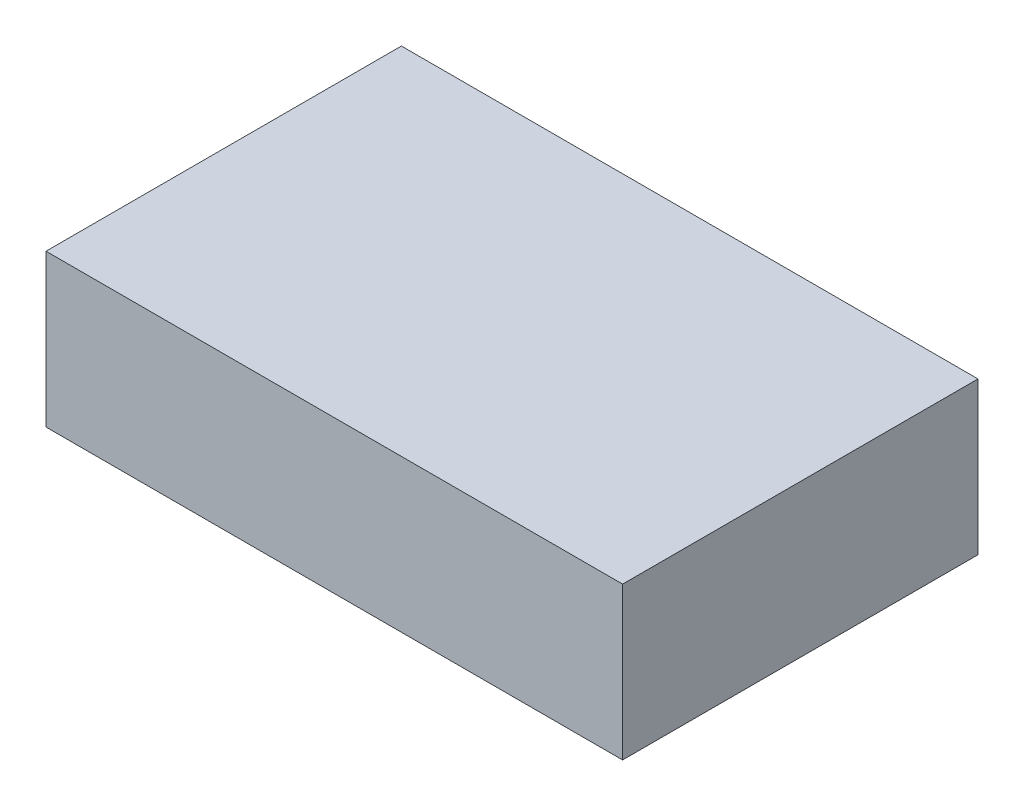
from build123d import *

# Parameters (mm, degrees)
SKETCH1_W           = 121.158
SKETCH1_H           = 74.676
BOSS_EXTRUDE1_DEPTH = 32.004


with BuildPart() as part:
    # Sketch1 → Boss-Extrude1 (new body)
    with BuildSketch(Plane(origin=(0, 0, 0), x_dir=(1, 0, 0), z_dir=(0, 1, 0))):
        with Locations((60.579, 37.338)):
            Rectangle(SKETCH1_W, SKETCH1_H)
    extrude(amount=BOSS_EXTRUDE1_DEPTH)


solid = part.part
